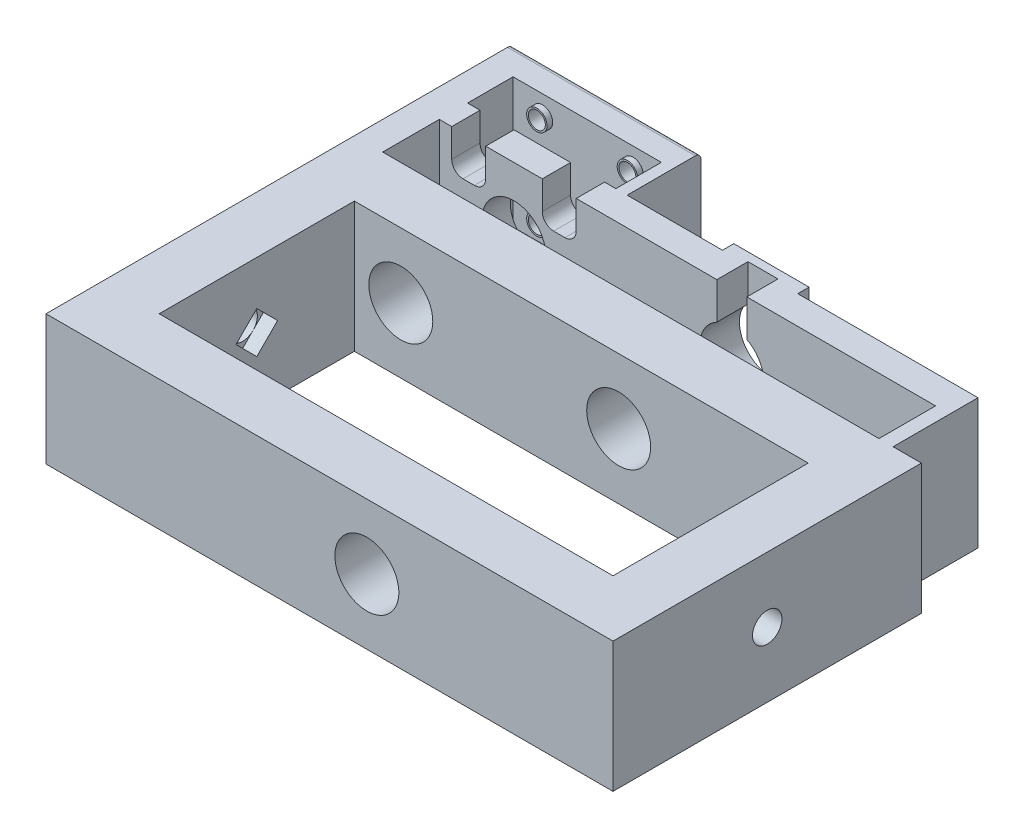
from build123d import *

# Parameters (mm, degrees)
SKETCH1_W           = 100.2
SKETCH1_H           = 54.5
SKETCH1_W_2         = 80.2
SKETCH1_H_2         = 34.5
BOSS_EXTRUDE1_DEPTH = 11.5
CUT_EXTRUDE1_REACH  = 106.474
SKETCH2_R           = 2.6
CUT_EXTRUDE2_REACH  = 76.917
SKETCH3_R           = 5.65
CUT_EXTRUDE3_START  = -2.5
CUT_EXTRUDE3_DEPTH  = 85.2
SKETCH5_R           = 5.65
CUT_EXTRUDE4_DEPTH  = 10
SKETCH6_W           = 26.2
SKETCH6_H           = 8.04
BOSS_EXTRUDE2_DEPTH = 11.5
SKETCH8_R           = 1.8
BOSS_EXTRUDE3_DEPTH = 1
CUT_EXTRUDE5_REACH  = 94.199
SKETCH9_R           = 1.5
CUT_EXTRUDE6_DEPTH  = 2.5
CUT_EXTRUDE7_START  = -5
SKETCH11_R          = 5.65
CUT_EXTRUDE7_DEPTH  = 5
CUT_EXTRUDE9_REACH  = 84.477
SKETCH12_R          = 5.65
SKETCH12_W          = 5.3
SKETCH12_H          = 6.51001002
FILLET1_R           = 1
BOSS_EXTRUDE5_START = 2
SKETCH13_W          = 13.3
SKETCH13_H          = 23
SKETCH13_R          = 5.65
BOSS_EXTRUDE5_DEPTH = 2
CUT_EXTRUDE10_START = -0.5
CUT_EXTRUDE10_DEPTH = 0.5
CUT_EXTRUDE11_DEPTH = 5


with BuildPart() as part:
    # Sketch1 → Boss-Extrude1 (new, symmetric)
    with BuildSketch(Plane(origin=(0, 0, 0), x_dir=(1, 0, 0), z_dir=(0, 1, 0))):
        Rectangle(SKETCH1_W, SKETCH1_H)
        Rectangle(SKETCH1_W_2, SKETCH1_H_2, mode=Mode.SUBTRACT)
    extrude(amount=BOSS_EXTRUDE1_DEPTH, both=True)

    # Cut-Extrude1: up to this face of the body (flat: up to its plane)
    cut_extrude1_end = Plane(part.part.faces().sort_by_distance((-50.1, 0, 0))[0])
    # Sketch2 → Cut-Extrude1 (cut, up to the picked face)
    with BuildSketch(Plane(origin=(50.1, 0, 0), x_dir=(0, 0, -1), z_dir=(1, 0, 0)), mode=Mode.PRIVATE) as cut_extrude1_sk1:
        Circle(SKETCH2_R)
    cut_extrude1_tool1 = split(extrude(cut_extrude1_sk1.sketch, amount=-CUT_EXTRUDE1_REACH, mode=Mode.PRIVATE), bisect_by=cut_extrude1_end, keep=Keep.BOTH, mode=Mode.PRIVATE)
    add(cut_extrude1_tool1.solids().sort_by(Axis((50.1, 0, 0), (-1, 0, 0)))[0], mode=Mode.SUBTRACT)

    # Cut-Extrude2: up to this face of the body (flat: up to its plane)
    cut_extrude2_end = Plane(part.part.faces().sort_by_distance((0, 0, 27.25))[0])
    # Sketch3 → Cut-Extrude2 (cut, up to the picked face)
    with BuildSketch(Plane(origin=(0, 0, -27.25), x_dir=(-1, 0, 0), z_dir=(0, 0, -1)), mode=Mode.PRIVATE) as cut_extrude2_sk1:
        with Locations((-6.6, 0)):
            Circle(SKETCH3_R)
    cut_extrude2_tool1 = split(extrude(cut_extrude2_sk1.sketch, amount=-CUT_EXTRUDE2_REACH, mode=Mode.PRIVATE), bisect_by=cut_extrude2_end, keep=Keep.BOTH, mode=Mode.PRIVATE)
    add(cut_extrude2_tool1.solids().sort_by(Axis((6.6, 0, -27.25), (0, 0, 1)))[0], mode=Mode.SUBTRACT)

    # Sketch4 → Cut-Extrude3 (cut)
    with BuildSketch(Plane.ZY.offset(-40.1).offset(CUT_EXTRUDE3_START)):
        with BuildLine():
            ThreePointArc((1.838477631, -1.838477631), (-3e-09, -2.6), (-1.838477635, -1.838477627))
            Line((-1.838477635, -1.838477627), (0, -3.676955262))
            Line((0, -3.676955262), (1.838477631, -1.838477631))
        make_face()
        with BuildLine():
            ThreePointArc((-1.838477635, -1.838477627), (-2.6, 3e-09), (-1.83847763, 1.838477632))
            Line((-1.83847763, 1.838477632), (-3.676955262, 0))
            Line((-3.676955262, 0), (-1.838477635, -1.838477627))
        make_face()
        with BuildLine():
            Line((1.838477625, 1.838477637), (0, 3.676955262))
            Line((0, 3.676955262), (-1.83847763, 1.838477632))
            ThreePointArc((-1.83847763, 1.838477632), (-4e-09, 2.6), (1.838477625, 1.838477637))
        make_face()
        with BuildLine():
            Line((3.676955262, 0), (1.838477625, 1.838477637))
            ThreePointArc((1.838477625, 1.838477637), (2.402086783, 0.994976928), (2.6, 0))
            ThreePointArc((2.6, 0), (2.402086785, -0.994976924), (1.838477631, -1.838477631))
            Line((1.838477631, -1.838477631), (3.676955262, 0))
        make_face()
    extrude(amount=CUT_EXTRUDE3_DEPTH, mode=Mode.SUBTRACT)

    # Sketch5 → Cut-Extrude4 (cut)
    with BuildSketch(Plane.XY.offset(-27.25)):
        with Locations((-31.9, 0)):
            Circle(SKETCH5_R)
    extrude(amount=CUT_EXTRUDE4_DEPTH, mode=Mode.SUBTRACT)

    # Sketch6 → Boss-Extrude2 (add, symmetric)
    with BuildSketch(Plane(origin=(0, 0, 0), x_dir=(1, 0, 0), z_dir=(0, 1, 0))):
        Polygon((-16.9, 55.29), (-50.1, 55.29), (-50.1, 27.25), (-45.1, 27.25), (-45.1, 37.25), (42.6, 37.25), (42.6, 27.25), (45.1, 27.25), (45.1, 42.25), (-16.9, 42.25), align=None)
        with Locations((-32, 46.27)):
            Rectangle(SKETCH6_W, SKETCH6_H, mode=Mode.SUBTRACT)
    extrude(amount=BOSS_EXTRUDE2_DEPTH, both=True)

    # Sketch8 → Boss-Extrude3 (add)
    with BuildSketch(Plane.XY.offset(-50.29)):
        with Locations((-39.9, 8)):
            Circle(SKETCH8_R)
        with Locations((-23.9, 8)):
            Circle(SKETCH8_R)
        with Locations((-23.9, -8)):
            Circle(SKETCH8_R)
        with Locations((-39.9, -8)):
            Circle(SKETCH8_R)
    extrude(amount=BOSS_EXTRUDE3_DEPTH)

    # Sketch9 → Cut-Extrude5 (cut, up to next)
    with BuildSketch(Plane.XY.offset(-49.29), mode=Mode.PRIVATE) as cut_extrude5_sk1:
        with Locations((-39.9, 8)):
            Circle(SKETCH9_R)
    cut_extrude5_tool1 = extrude(cut_extrude5_sk1.sketch, amount=-CUT_EXTRUDE5_REACH, mode=Mode.PRIVATE) & part.part
    # Sketch9 → Cut-Extrude5 (cut, up to next)
    with BuildSketch(Plane.XY.offset(-49.29), mode=Mode.PRIVATE) as cut_extrude5_sk2:
        with Locations((-23.9, 8)):
            Circle(SKETCH9_R)
    cut_extrude5_tool2 = extrude(cut_extrude5_sk2.sketch, amount=-CUT_EXTRUDE5_REACH, mode=Mode.PRIVATE) & part.part
    # Sketch9 → Cut-Extrude5 (cut, up to next)
    with BuildSketch(Plane.XY.offset(-49.29), mode=Mode.PRIVATE) as cut_extrude5_sk3:
        with Locations((-23.9, -8)):
            Circle(SKETCH9_R)
    cut_extrude5_tool3 = extrude(cut_extrude5_sk3.sketch, amount=-CUT_EXTRUDE5_REACH, mode=Mode.PRIVATE) & part.part
    # Sketch9 → Cut-Extrude5 (cut, up to next)
    with BuildSketch(Plane.XY.offset(-49.29), mode=Mode.PRIVATE) as cut_extrude5_sk4:
        with Locations((-39.9, -8)):
            Circle(SKETCH9_R)
    cut_extrude5_tool4 = extrude(cut_extrude5_sk4.sketch, amount=-CUT_EXTRUDE5_REACH, mode=Mode.PRIVATE) & part.part
    add(cut_extrude5_tool1.solids().sort_by_distance((-39.9, 8, -49.29))[0], mode=Mode.SUBTRACT)
    add(cut_extrude5_tool2.solids().sort_by_distance((-23.9, 8, -49.29))[0], mode=Mode.SUBTRACT)
    add(cut_extrude5_tool3.solids().sort_by_distance((-23.9, -8, -49.29))[0], mode=Mode.SUBTRACT)
    add(cut_extrude5_tool4.solids().sort_by_distance((-39.9, -8, -49.29))[0], mode=Mode.SUBTRACT)

    # Sketch10 → Cut-Extrude6 (cut)
    with BuildSketch(Plane(origin=(0, 0, -55.29), x_dir=(-1, 0, 0), z_dir=(0, 0, -1))):
        Polygon((26.7, 6.383419246), (26.7, 9.616580754), (23.9, 11.233161507), (21.1, 9.616580754), (21.1, 6.383419246), (23.9, 4.766838493), align=None)
        Polygon((42.7, 6.383419246), (42.7, 9.616580754), (39.9, 11.233161507), (37.1, 9.616580754), (37.1, 6.383419246), (39.9, 4.766838493), align=None)
        Polygon((42.7, -9.616580754), (42.7, -6.383419246), (39.9, -4.766838493), (37.1, -6.383419246), (37.1, -9.616580754), (39.9, -11.233161507), align=None)
        Polygon((26.7, -9.616580754), (26.7, -6.383419246), (23.9, -4.766838493), (21.1, -6.383419246), (21.1, -9.616580754), (23.9, -11.233161507), align=None)
    extrude(amount=-CUT_EXTRUDE6_DEPTH, mode=Mode.SUBTRACT)

    # Sketch11 → Cut-Extrude7 (cut)
    with BuildSketch(Plane.XY.offset(-37.25).offset(CUT_EXTRUDE7_START)):
        with Locations((-31.9, 0)):
            Circle(SKETCH11_R)
    extrude(amount=CUT_EXTRUDE7_DEPTH, mode=Mode.SUBTRACT)

    # Sketch12 → Cut-Extrude9 (cut, up to next)
    with BuildSketch(Plane.XY.offset(-37.25), mode=Mode.PRIVATE) as cut_extrude9_sk1:
        with Locations(Location((6.6, 0, 0), (0, 0, 180))):
            Circle(SKETCH12_R)
    cut_extrude9_tool1 = extrude(cut_extrude9_sk1.sketch, amount=-CUT_EXTRUDE9_REACH, mode=Mode.PRIVATE) & part.part
    # Sketch12 → Cut-Extrude9 (cut, up to next)
    with BuildSketch(Plane.XY.offset(-37.25), mode=Mode.PRIVATE) as cut_extrude9_sk2:
        with Locations((6.6, 8.24499499)):
            Rectangle(SKETCH12_W, SKETCH12_H)
    cut_extrude9_tool2 = extrude(cut_extrude9_sk2.sketch, amount=-CUT_EXTRUDE9_REACH, mode=Mode.PRIVATE) & part.part
    add(cut_extrude9_tool1.solids().sort_by_distance((6.6, 0, -37.25))[0], mode=Mode.SUBTRACT)
    add(cut_extrude9_tool2.solids().sort_by_distance((6.6, 8.244995, -37.25))[0], mode=Mode.SUBTRACT)

    # Fillet1
    # the kernel refuses this fillet: 1 mm, written as the material it takes off along each edge
    with BuildSketch(Plane(origin=(-14.4, 11.5, -55.29), x_dir=(0, -1, 0), z_dir=(-1, 0, 0)), Plane(origin=(-14.4, -11.5, -55.29), x_dir=(0, 0, 1), z_dir=(-1, 0, 0))) as fillet1_piece_1:
        with BuildLine():
            CenterArc((FILLET1_R, FILLET1_R), FILLET1_R, 180, 90)
            Line((0, FILLET1_R), (0, 0))
            Line((0, 0), (FILLET1_R, 0))
        make_face()
    extrude(amount=38.2, mode=Mode.SUBTRACT)

    # Sketch13 → Boss-Extrude5 (add)
    with BuildSketch(Plane(origin=(0, 0, -42.25), x_dir=(-1, 0, 0), z_dir=(0, 0, -1)).offset(BOSS_EXTRUDE5_START)):
        with Locations((-6.6, 0)):
            Rectangle(SKETCH13_W, SKETCH13_H)
        with Locations((-6.6, 0)):
            Circle(SKETCH13_R, mode=Mode.SUBTRACT)
    extrude(amount=-BOSS_EXTRUDE5_DEPTH)

    # Sketch14 → Cut-Extrude10 (cut)
    with BuildSketch(Plane.XY.offset(-42.25).offset(CUT_EXTRUDE10_START)):
        with BuildLine():
            Line((3.95, 11.5), (3.95, 4.98998998))
            ThreePointArc((3.95, 4.98998998), (6.6, 5.65), (9.25, 4.98998998))
            Line((9.25, 4.98998998), (9.25, 11.5))
            Line((9.25, 11.5), (3.95, 11.5))
        make_face()
    extrude(amount=CUT_EXTRUDE10_DEPTH, mode=Mode.SUBTRACT)

    # Sketch15 → Cut-Extrude11 (cut)
    with BuildSketch(Plane(origin=(0, 0, -42.25), x_dir=(-1, 0, 0), z_dir=(0, 0, -1))):
        with BuildLine():
            Line((22.9, 4.5), (24.9, 4.5))
            ThreePointArc((24.9, 4.5), (26.314213562, 5.085786438), (26.9, 6.5))
            Line((26.9, 6.5), (26.9, 11.5))
            Line((26.9, 11.5), (20.9, 11.5))
            Line((20.9, 11.5), (20.9, 6.5))
            ThreePointArc((20.9, 6.5), (21.485786438, 5.085786438), (22.9, 4.5))
        make_face()
        with BuildLine():
            Line((40.9, 4.5), (38.9, 4.5))
            ThreePointArc((38.9, 4.5), (37.485786438, 5.085786438), (36.9, 6.5))
            Line((36.9, 6.5), (36.9, 11.5))
            Line((36.9, 11.5), (42.9, 11.5))
            Line((42.9, 11.5), (42.9, 6.5))
            ThreePointArc((42.9, 6.5), (42.314213562, 5.085786438), (40.9, 4.5))
        make_face()
        with BuildLine():
            Line((40.9, -4.5), (38.9, -4.5))
            ThreePointArc((38.9, -4.5), (37.485786438, -5.085786438), (36.9, -6.5))
            Line((36.9, -6.5), (36.9, -11.5))
            Line((36.9, -11.5), (42.9, -11.5))
            Line((42.9, -11.5), (42.9, -6.5))
            ThreePointArc((42.9, -6.5), (42.314213562, -5.085786438), (40.9, -4.5))
        make_face()
        with BuildLine():
            Line((22.9, -4.5), (24.9, -4.5))
            ThreePointArc((24.9, -4.5), (26.314213562, -5.085786438), (26.9, -6.5))
            Line((26.9, -6.5), (26.9, -11.5))
            Line((26.9, -11.5), (20.9, -11.5))
            Line((20.9, -11.5), (20.9, -6.5))
            ThreePointArc((20.9, -6.5), (21.485786438, -5.085786438), (22.9, -4.5))
        make_face()
    extrude(amount=-CUT_EXTRUDE11_DEPTH, mode=Mode.SUBTRACT)


solid = part.part
